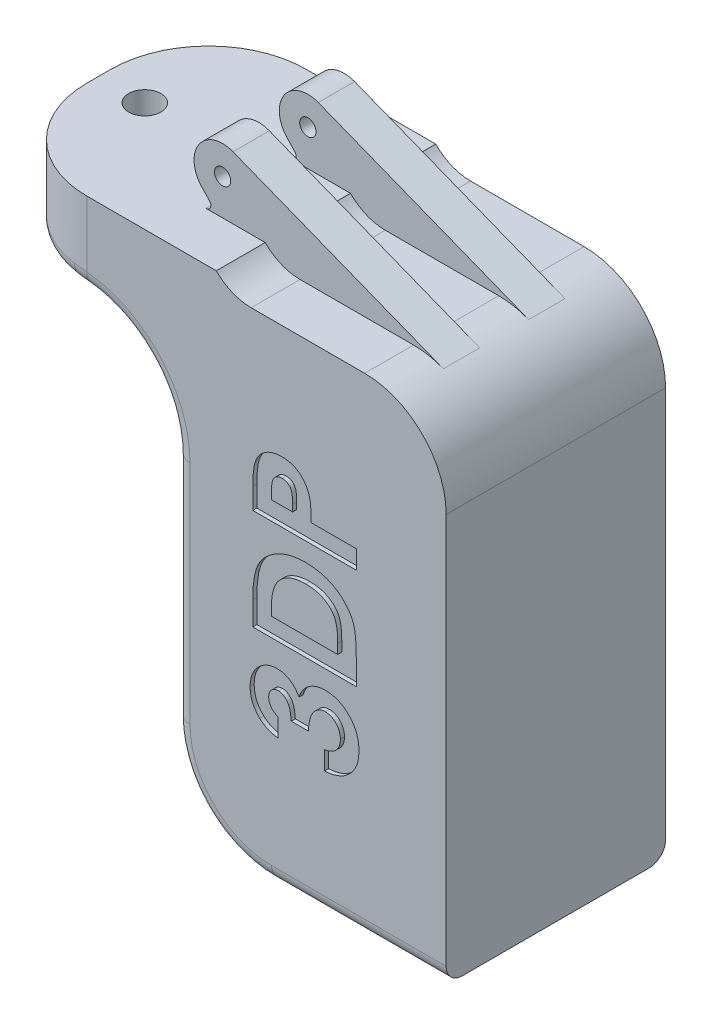
from build123d import *

# Parameters (mm, degrees)
BOSS_EXTRUDE1_DEPTH = 26.91519165
BOSS_EXTRUDE2_DEPTH = 26.91519165
FILLET1_R           = 12
FILLET2_R           = 12
SKETCH4_R           = 1.975
CUT_EXTRUDE1_DEPTH  = 5
FILLET3_R           = 2
FILLET4_R           = 0.6
SKETCH5_R           = 1
CUT_EXTRUDE2_DEPTH  = 33
SKETCH6_W           = 18.03011809
SKETCH6_H           = 6
CUT_EXTRUDE3_DEPTH  = 33
SKETCH7_W           = 12.282064414
SKETCH7_H           = 6
CUT_EXTRUDE4_DEPTH  = 33
FILLET5_R           = 10
BOSS_EXTRUDE3_DEPTH = 4.457595825
BOSS_EXTRUDE4_START = -4.457595825
BOSS_EXTRUDE4_DEPTH = 4.457595825
WRAP1_START         = -0.5
WRAP1_DEPTH         = 0.5
WRAP2_START         = -0.5
WRAP2_DEPTH         = 0.5


# Read off the part's stored shape, not the designer's step: Wrap1, Wrap2
with BuildPart() as part:
    # Sketch1 → Boss-Extrude1 (new body)
    with BuildSketch(Plane.XY):
        with BuildLine():
            Line((20.5, -63.197553089), (50.42158649, -63.197553089))
            Line((50.42158649, -63.197553089), (50.42158649, -3.197553089))
            Line((50.42158649, -3.197553089), (26.5, -3.197553089))
            ThreePointArc((26.5, -3.197553089), (22.257359313, -1.440193776), (20.5, 2.802446911))
            Line((20.5, 2.802446911), (20.5, 3))
            ThreePointArc((20.5, 3), (15.70294041, 6.250790123), (14.461350617, 0.590589427))
            Line((14.461350617, 0.590589427), (17, -2.08423103))
            Line((17, -2.08423103), (17, -63.197553089))
            Line((17, -63.197553089), (20.5, -63.197553089))
        make_face()
    extrude(amount=-BOSS_EXTRUDE1_DEPTH)

    # Sketch3 → Boss-Extrude2 (add)
    with BuildSketch(Plane.XY):
        Polygon((16.359537753, -1.409414913), (-5.640462247, -1.409414913), (-5.640462247, -11.409414913), (17, -11.409414913), (17, -2.08423103), align=None)
    extrude(amount=-BOSS_EXTRUDE2_DEPTH)

    # Fillet1
    fillet1_edges = [part.edges().sort_by_distance(p)[0] for p in [
        (-5.640462247, -6.409414913, 0),
        (-5.640462247, -6.409414913, -26.91519165),
    ]]
    fillet(fillet1_edges, radius=FILLET1_R)

    # Fillet2
    fillet2_edges = [part.edges().sort_by_distance(p)[0] for p in [
        (17, -63.197553089, -13.457595825),
        (17, -11.409414913, -13.457595825),
    ]]
    fillet(fillet2_edges, radius=FILLET2_R)

    # Sketch4 → Cut-Extrude1 (cut)
    with BuildSketch(Plane(origin=(0, -1.409414913, 0), x_dir=(1, 0, 0), z_dir=(0, 1, 0))):
        with Locations(Location((0, 13.457595825, 0), (0, 0, 180))):
            Circle(SKETCH4_R)
    extrude(amount=-CUT_EXTRUDE1_DEPTH, mode=Mode.SUBTRACT)

    # Fillet3
    fillet3_edges = [part.edges().sort_by_distance(p)[0] for p in [
        (-5.640462247, -11.409414913, -13.457595825),
        (-2.593519072, -11.409414913, -22.90535895),
        (17, -37.303484001, -26.91519165),
        (17, -37.303484001, 0),
        (39.710793245, -63.197553089, 0),
        (20.514718626, -59.682834464, 0),
        (39.710793245, -63.197553089, -26.91519165),
        (20.514718626, -59.682834464, -26.91519165),
        (-2.593519072, -11.409414913, -4.0098327),
        (5.679768877, -11.428683956, -0.019269043),
        (13.953056825, -15.419247614, 0),
        (13.953056825, -15.419247614, -26.91519165),
        (5.679768877, -11.428683956, -26.895922607),
    ]]
    fillet(fillet3_edges, radius=FILLET3_R)

    # Fillet4
    fillet4_edges = [part.edges().sort_by_distance(p)[0] for p in [
        (16.359537753, -1.409414913, -13.457595825),
    ]]
    fillet(fillet4_edges, radius=FILLET4_R)

    # Sketch5 → Cut-Extrude2 (cut)
    with BuildSketch(Plane.XY):
        with Locations((17, 3)):
            Circle(SKETCH5_R)
    extrude(amount=-CUT_EXTRUDE2_DEPTH, mode=Mode.SUBTRACT)

    # Sketch6 → Cut-Extrude3 (cut)
    with BuildSketch(Plane(origin=(0, -1.409414913, 0), x_dir=(1, 0, 0), z_dir=(0, 1, 0))):
        with Locations((18.559970367, 3)):
            Rectangle(SKETCH6_W, SKETCH6_H)
    extrude(amount=CUT_EXTRUDE3_DEPTH, mode=Mode.SUBTRACT)

    # Sketch7 → Cut-Extrude4 (cut)
    with BuildSketch(Plane(origin=(0, -1.409414913, 0), x_dir=(1, 0, 0), z_dir=(0, 1, 0))):
        with Locations((16.08576993, 23.91519165)):
            Rectangle(SKETCH7_W, SKETCH7_H)
        with Locations((16.08576993, 13.457595825)):
            Rectangle(SKETCH7_W, SKETCH7_H)
    extrude(amount=CUT_EXTRUDE4_DEPTH, mode=Mode.SUBTRACT)

    # Fillet5
    fillet5_edges = [part.edges().sort_by_distance(p)[0] for p in [
        (50.42158649, -3.197553089, -13.457595825),
    ]]
    fillet(fillet5_edges, radius=FILLET5_R)

    # Sketch8 → Boss-Extrude3 (add)
    with BuildSketch(Plane.XY.offset(-6)):
        with BuildLine():
            Line((18.28116245, 6.257088082), (44.082050633, -3.89158714))
            ThreePointArc((44.082050633, -3.89158714), (42.284425788, -3.37259356), (40.42158649, -3.197553089))
            Line((40.42158649, -3.197553089), (26.5, -3.197553089))
            ThreePointArc((26.5, -3.197553089), (24.183879423, -2.732495318), (22.226802137, -1.409414913))
            ThreePointArc((22.226802137, -1.409414913), (20.948460251, 0.526396294), (20.5, 2.802446911))
            Line((20.5, 2.802446911), (20.5, 3))
            ThreePointArc((20.5, 3), (19.892582633, 4.970524223), (18.28116245, 6.257088082))
        make_face()
    extrude(amount=-BOSS_EXTRUDE3_DEPTH)

    # Sketch10 → Boss-Extrude4 (add)
    with BuildSketch(Plane(origin=(0, 0, -20.91519165), x_dir=(-1, 0, 0), z_dir=(0, 0, -1)).offset(BOSS_EXTRUDE4_START)):
        with BuildLine():
            Line((-44.082050633, -3.89158714), (-18.28116245, 6.257088082))
            ThreePointArc((-18.28116245, 6.257088082), (-19.892582633, 4.970524223), (-20.5, 3))
            Line((-20.5, 3), (-20.5, 2.802446911))
            ThreePointArc((-20.5, 2.802446911), (-20.948460251, 0.526396294), (-22.226802137, -1.409414913))
            ThreePointArc((-22.226802137, -1.409414913), (-24.183879423, -2.732495318), (-26.5, -3.197553089))
            Line((-26.5, -3.197553089), (-40.42158649, -3.197553089))
            ThreePointArc((-40.42158649, -3.197553089), (-42.284425788, -3.37259356), (-44.082050633, -3.89158714))
        make_face()
    extrude(amount=BOSS_EXTRUDE4_DEPTH)

    # Wrap1 outline → Wrap1 (cut)
    # profile 1 of 3: a face of its own
    with BuildSketch(Plane.XY.offset(WRAP1_START)):
        with BuildLine():
            add(Edge.make_bspline(
                [(29.793662682, -47.259674624), (29.679694315, -47.243680976), (29.457085889, -47.212441424), (29.134033392, -47.135646016), (28.826834298, -47.046836784), (28.53713725, -46.933262335), (28.265254543, -46.802161124), (28.010942879, -46.649279319), (27.770552672, -46.481710734), (27.626494259, -46.350515009), (27.554880631, -46.285295618)],
                knots=[0, 0, 0, 0, 0.138943325, 0.2713907, 0.400711228, 0.524932707, 0.646800357, 0.764858493, 0.883107579, 1, 1, 1, 1], degree=3))
            Line((29.793662682, -47.259674624), (29.793662682, -44.980187445))
            add(Edge.make_bspline(
                [(28.653919092, -43.494450265), (28.657984461, -43.577042735), (28.666051398, -43.740931491), (28.726260879, -43.980585907), (28.827616047, -44.208177758), (28.96737885, -44.418994259), (29.135228052, -44.60999223), (29.334010592, -44.766746459), (29.551817063, -44.897127195), (29.712731442, -44.952392155), (29.793662682, -44.980187445)],
                knots=[0, 0, 0, 0, 0.123522589, 0.245106649, 0.36726561, 0.494690546, 0.622323873, 0.746002836, 0.872253148, 1, 1, 1, 1], degree=3))
            add(Edge.make_bspline(
                [(29.849632233, -42.212238727), (29.766930947, -42.21661778), (29.605515545, -42.225164764), (29.374084101, -42.29284717), (29.166688952, -42.407707014), (28.985649891, -42.563553512), (28.837973958, -42.755012631), (28.728141079, -42.976591692), (28.664068623, -43.227167915), (28.657378891, -43.40333836), (28.653919092, -43.494450265)],
                knots=[0, 0, 0, 0, 0.126165598, 0.246248538, 0.364494603, 0.485724426, 0.608514578, 0.73130473, 0.861036067, 1, 1, 1, 1], degree=3))
            add(Edge.make_bspline(
                [(31.42186781, -44.654546419), (31.40904774, -44.503428084), (31.385063928, -44.220715606), (31.328187448, -43.828565407), (31.254610772, -43.497301408), (31.158720422, -43.223137182), (31.046713588, -42.99171911), (30.916934876, -42.792391977), (30.767908317, -42.618485027), (30.599851049, -42.475439303), (30.423692764, -42.356231745), (30.236339235, -42.27462788), (30.045244717, -42.21993119), (29.914444082, -42.214787453), (29.849632233, -42.212238727)],
                knots=[0, 0, 0, 0, 0.141725991, 0.265141262, 0.370116044, 0.458355648, 0.535986621, 0.609852304, 0.680090865, 0.749211452, 0.815601441, 0.878051616, 0.93957445, 1, 1, 1, 1], degree=3))
            Line((31.42186781, -44.654546419), (33.538534477, -44.654546419))
            add(Edge.make_bspline(
                [(35.591599381, -41.560956675), (35.521865865, -41.563278441), (35.383876528, -41.567872773), (35.181659761, -41.608302676), (34.986390275, -41.668820275), (34.799679191, -41.755855816), (34.622624577, -41.869745696), (34.45376006, -42.00822411), (34.294430079, -42.17254377), (34.139994301, -42.35720205), (34.004801952, -42.569649592), (33.880310015, -42.801307426), (33.78118375, -43.057882639), (33.692667259, -43.333219952), (33.628010792, -43.632496359), (33.581065463, -43.953862488), (33.546121475, -44.296797294), (33.541108222, -44.533186823), (33.538534477, -44.654546419)],
                knots=[0, 0, 0, 0, 0.050616766, 0.100160932, 0.149266408, 0.198883313, 0.249304704, 0.301846101, 0.357178164, 0.415398685, 0.476408327, 0.539798233, 0.60615782, 0.675919782, 0.74976587, 0.828276339, 0.911839098, 1, 1, 1, 1], degree=3))
            add(Edge.make_bspline(
                [(37.446226785, -43.560596098), (37.445011729, -43.490133273), (37.442631707, -43.352112362), (37.416491829, -43.149328443), (37.372939422, -42.956346104), (37.31535741, -42.771562698), (37.237218938, -42.597882151), (37.146539501, -42.431372035), (37.03553414, -42.27507746), (36.909054065, -42.129908906), (36.773996634, -41.994805434), (36.626208402, -41.879442714), (36.472785654, -41.779844315), (36.30967031, -41.701254478), (36.142011638, -41.635479646), (35.964480714, -41.594456903), (35.780931109, -41.563668655), (35.655339645, -41.561869688), (35.591599381, -41.560956675)],
                knots=[0, 0, 0, 0, 0.069418935, 0.135976164, 0.201068785, 0.264244252, 0.326365932, 0.38847074, 0.450850536, 0.514855453, 0.578097235, 0.638796917, 0.699312171, 0.757998888, 0.816988375, 0.876385038, 0.937262852, 1, 1, 1, 1], degree=3))
            add(Edge.make_bspline(
                [(35.492380631, -45.631469496), (35.572252479, -45.617021806), (35.727823851, -45.588881142), (35.953078761, -45.53404413), (36.160921135, -45.462395911), (36.35287794, -45.380480737), (36.530919166, -45.289913895), (36.690283678, -45.181702221), (36.837234507, -45.065675298), (37.006144585, -44.891260395), (37.183282522, -44.647911648), (37.340163988, -44.318431755), (37.429388386, -43.950244583), (37.440489168, -43.693367265), (37.446226785, -43.560596098)],
                knots=[0, 0, 0, 0, 0.077370852, 0.150700025, 0.220747386, 0.286665961, 0.349581574, 0.410791325, 0.470003976, 0.527741387, 0.64173813, 0.755286834, 0.87351607, 1, 1, 1, 1], degree=3))
            Line((35.492380631, -45.631469496), (35.492380631, -47.910956675))
            add(Edge.make_bspline(
                [(39.725713964, -43.685255553), (39.72247289, -43.833828888), (39.716135397, -44.124344383), (39.66128119, -44.549284097), (39.572796902, -44.953149071), (39.448070962, -45.336969976), (39.286322731, -45.69926184), (39.093716882, -46.043310066), (38.859144355, -46.362249248), (38.593194199, -46.659632995), (38.294813224, -46.92886444), (37.970913277, -47.169493949), (37.620262701, -47.3762156), (37.244359619, -47.54987716), (36.842544586, -47.689120989), (36.415634712, -47.798956113), (35.962795948, -47.875677745), (35.651233245, -47.899043478), (35.492380631, -47.910956675)],
                knots=[0, 0, 0, 0, 0.066659045, 0.130342942, 0.191936224, 0.251995802, 0.311121943, 0.3697548, 0.428602208, 0.488435845, 0.548524359, 0.60866107, 0.669235799, 0.730880799, 0.794196272, 0.859830406, 0.928533466, 1, 1, 1, 1], degree=3))
            add(Edge.make_bspline(
                [(35.614496015, -39.281469496), (35.75541144, -39.285828806), (36.03326796, -39.294424477), (36.442521412, -39.349073074), (36.832711166, -39.450814953), (37.208313016, -39.584675133), (37.564529662, -39.76318106), (37.909339638, -39.973432657), (38.231049551, -40.230787146), (38.535833303, -40.519386069), (38.814280771, -40.838218648), (39.060292199, -41.181303188), (39.263089604, -41.549304401), (39.436428178, -41.933325424), (39.565072658, -42.342017422), (39.659280759, -42.770093658), (39.716599833, -43.22068011), (39.722632856, -43.528201954), (39.725713964, -43.685255553)],
                knots=[0, 0, 0, 0, 0.062826775, 0.123881606, 0.183570574, 0.242287944, 0.301291813, 0.360878938, 0.421986412, 0.484557904, 0.547788277, 0.610411137, 0.672354816, 0.73480514, 0.797929196, 0.862961244, 0.93001333, 1, 1, 1, 1], degree=3))
            add(Edge.make_bspline(
                [(32.36571797, -41.63219065), (32.395435252, -41.541662854), (32.453828378, -41.363779795), (32.568904013, -41.110991399), (32.694395385, -40.870420668), (32.840893141, -40.647569372), (32.998243164, -40.436326343), (33.1749057, -40.243375025), (33.366346101, -40.063719006), (33.574600933, -39.901802756), (33.796207672, -39.757042122), (34.027183263, -39.629465989), (34.268371885, -39.522405635), (34.518001132, -39.432550417), (34.778527767, -39.363993374), (35.049068901, -39.315761008), (35.328972672, -39.287872438), (35.518608617, -39.283619798), (35.614496015, -39.281469496)],
                knots=[0, 0, 0, 0, 0.066210963, 0.130101573, 0.192891272, 0.254723742, 0.31534918, 0.375885633, 0.436387606, 0.497731609, 0.559069942, 0.62030329, 0.681020445, 0.742389955, 0.80461491, 0.86812333, 0.933317965, 1, 1, 1, 1], degree=3))
            add(Edge.make_bspline(
                [(29.704620214, -39.932751547), (29.842416769, -39.938147512), (30.114526826, -39.948803049), (30.511996536, -40.033072716), (30.891185338, -40.168541012), (31.247600382, -40.361156854), (31.58087039, -40.603040267), (31.879355738, -40.899664437), (32.147678995, -41.242751757), (32.291877756, -41.500304819), (32.36571797, -41.63219065)],
                knots=[0, 0, 0, 0, 0.124097087, 0.245057399, 0.36448446, 0.485868975, 0.60892619, 0.734308661, 0.863946782, 1, 1, 1, 1], degree=3))
            add(Edge.make_bspline(
                [(26.374431913, -43.479185842), (26.37733782, -43.35609612), (26.383050248, -43.114126531), (26.428906519, -42.758492119), (26.509333311, -42.419424469), (26.614489538, -42.093339536), (26.757572159, -41.785032969), (26.923660628, -41.487700142), (27.127375037, -41.209648544), (27.357551818, -40.950227588), (27.60651054, -40.711899962), (27.872626939, -40.505507193), (28.148792434, -40.328067627), (28.437301437, -40.181880894), (28.73864214, -40.069483162), (29.051073738, -39.991475802), (29.373906829, -39.940418092), (29.593332132, -39.93533141), (29.704620214, -39.932751547)],
                knots=[0, 0, 0, 0, 0.068213911, 0.134094803, 0.198285615, 0.261160186, 0.323634654, 0.38636675, 0.449642386, 0.514244902, 0.578413338, 0.640374686, 0.70061485, 0.760103977, 0.81929898, 0.878465984, 0.938360402, 1, 1, 1, 1], degree=3))
            add(Edge.make_bspline(
                [(27.554880631, -46.285295618), (27.460245557, -46.191457288), (27.273729773, -46.006511803), (27.034823657, -45.697446207), (26.82806666, -45.373488384), (26.664148218, -45.02814122), (26.531475228, -44.666778575), (26.442358481, -44.28652677), (26.383228733, -43.88893965), (26.377404247, -43.617636458), (26.374431913, -43.479185842)],
                knots=[0, 0, 0, 0, 0.127406864, 0.251105539, 0.372907792, 0.494496302, 0.616171436, 0.740562898, 0.867604851, 1, 1, 1, 1], degree=3))
        make_face()
    # profile 2 of 3: a face of its own
    with BuildSketch(Plane.XY.offset(WRAP1_START)):
        with BuildLine():
            add(Edge.make_bspline(
                [(26.700072938, -34.129726707), (26.701602041, -33.905795857), (26.704557813, -33.472934992), (26.73913827, -32.845894461), (26.789912576, -32.262388484), (26.867639291, -31.723746195), (26.957795121, -31.227997365), (27.078733297, -30.778902431), (27.216634224, -30.373204929), (27.379324524, -30.006964684), (27.568904674, -29.672607458), (27.78010635, -29.355128565), (28.020637712, -29.055146138), (28.285866069, -28.768451804), (28.580641597, -28.498745033), (28.900082319, -28.241534344), (29.248820405, -28.003117396), (29.618494261, -27.776287366), (30.010670516, -27.571149788), (30.422011051, -27.392221126), (30.849868736, -27.242331502), (31.294699556, -27.120538419), (31.755026808, -27.023455277), (32.231779389, -26.955528159), (32.724515906, -26.913534938), (33.058467638, -26.909275076), (33.228157874, -26.907110521)],
                knots=[0, 0, 0, 0, 0.060148874, 0.116268453, 0.168655952, 0.21743294, 0.262424792, 0.303924461, 0.342252181, 0.37743397, 0.411399132, 0.445391786, 0.479760229, 0.514578736, 0.550208327, 0.586996019, 0.624658544, 0.663611474, 0.703452918, 0.743447125, 0.784010829, 0.825130466, 0.867263092, 0.910305411, 0.954423665, 1, 1, 1, 1], degree=3))
            Line((26.700072938, -34.129726707), (26.700072938, -37.001982316))
            Line((26.700072938, -37.001982316), (39.400072938, -37.001982316))
            Line((39.400072938, -37.001982316), (39.400072938, -34.086477509))
            add(Edge.make_bspline(
                [(33.228157874, -26.907110521), (33.467601844, -26.912778495), (33.938961313, -26.923936232), (34.630675905, -27.017922776), (35.293753331, -27.169930842), (35.923006744, -27.383667989), (36.512832544, -27.648644836), (37.052829427, -27.965189349), (37.540098861, -28.328660259), (37.972215016, -28.73482307), (38.343623694, -29.174598582), (38.661711623, -29.63161364), (38.912537941, -30.110322131), (39.071637644, -30.532127029), (39.17049322, -30.897894585), (39.229227491, -31.219000738), (39.281638665, -31.583991303), (39.328451546, -31.995286488), (39.359650825, -32.452845815), (39.381498194, -32.956746724), (39.397647795, -33.506328066), (39.399243376, -33.888027214), (39.400072938, -34.086477509)],
                knots=[0, 0, 0, 0, 0.065772437, 0.129476892, 0.191428604, 0.252443711, 0.311784541, 0.368814691, 0.42408823, 0.478488396, 0.531389624, 0.581999458, 0.631196377, 0.67949774, 0.705555904, 0.735216023, 0.769126523, 0.806877245, 0.848930943, 0.895117474, 0.945470227, 1, 1, 1, 1], degree=3))
        make_face()
        with BuildLine():
            add(Edge.make_bspline(
                [(37.120585759, -33.531870137), (37.119899873, -33.390228608), (37.118580886, -33.11784605), (37.100458158, -32.72410683), (37.071029, -32.360739082), (37.027498843, -32.027266845), (36.975120922, -31.722923489), (36.910336338, -31.448819175), (36.83155335, -31.20441365), (36.738706801, -30.987691442), (36.632701869, -30.789828851), (36.508920795, -30.606525159), (36.371360763, -30.429614765), (36.216100559, -30.262367314), (36.045162194, -30.104160228), (35.857674297, -29.955926689), (35.654206307, -29.815688968), (35.433683163, -29.687046482), (35.198433435, -29.569492301), (34.950735917, -29.465208567), (34.688527805, -29.378741964), (34.414263688, -29.306876217), (34.125555784, -29.255519992), (33.824542513, -29.213032511), (33.510031286, -29.191128977), (33.296027335, -29.188122853), (33.187452746, -29.186597701)],
                knots=[0, 0, 0, 0, 0.062612326, 0.120406111, 0.174204843, 0.223728185, 0.269030291, 0.310675957, 0.348139427, 0.382401014, 0.41477486, 0.447215928, 0.480063858, 0.51375667, 0.547979264, 0.582933279, 0.619329216, 0.657136258, 0.695697859, 0.735523522, 0.775831512, 0.817659023, 0.860747747, 0.905390435, 0.951999977, 1, 1, 1, 1], degree=3))
            Line((37.120585759, -33.531870137), (37.120585759, -34.722495137))
            Line((37.120585759, -34.722495137), (28.979560118, -34.722495137))
            Line((28.979560118, -34.722495137), (28.979560118, -33.852423021))
            add(Edge.make_bspline(
                [(29.997188323, -30.384854912), (29.914513245, -30.479314588), (29.745658759, -30.672237781), (29.543327904, -31.010947509), (29.365560415, -31.384188086), (29.224610622, -31.80049814), (29.113141516, -32.255854217), (29.036264, -32.752968428), (28.986863323, -33.289178618), (28.982046675, -33.660652544), (28.979560118, -33.852423021)],
                knots=[0, 0, 0, 0, 0.101663476, 0.207636138, 0.318744567, 0.436679942, 0.563506646, 0.698681208, 0.844446556, 1, 1, 1, 1], degree=3))
            add(Edge.make_bspline(
                [(33.187452746, -29.186597701), (33.021068674, -29.189624393), (32.696632625, -29.195526208), (32.224147528, -29.252797822), (31.779788909, -29.345079103), (31.364698281, -29.479507423), (30.976236729, -29.644819104), (30.619410066, -29.855016361), (30.288369519, -30.097329689), (30.094206114, -30.289055244), (29.997188323, -30.384854912)],
                knots=[0, 0, 0, 0, 0.142280365, 0.277435688, 0.406487662, 0.529917848, 0.650133875, 0.766844668, 0.88349908, 1, 1, 1, 1], degree=3))
        make_face(mode=Mode.SUBTRACT)
    # profile 3 of 3: a face of its own
    with BuildSketch(Plane.XY.offset(WRAP1_START)):
        with BuildLine():
            add(Edge.make_bspline(
                [(26.700072938, -22.083552829), (26.700817001, -21.917326561), (26.702252455, -21.596641247), (26.719659281, -21.134186657), (26.750853288, -20.707549596), (26.789404406, -20.31682834), (26.843450697, -19.962182705), (26.905413212, -19.643171282), (26.980892876, -19.359719159), (27.070513958, -19.108657994), (27.17608129, -18.883269215), (27.288838892, -18.670229349), (27.422495572, -18.472744789), (27.567417095, -18.286179159), (27.726618424, -18.111943735), (27.899470362, -17.9487474), (28.08848495, -17.798270622), (28.292360047, -17.661456795), (28.506944899, -17.537277383), (28.732728851, -17.428803993), (28.970040429, -17.340811847), (29.217352269, -17.266998673), (29.474651457, -17.207710866), (29.743520998, -17.168247098), (30.022083378, -17.141441297), (30.211673116, -17.139076057), (30.307564926, -17.137879752)],
                knots=[0, 0, 0, 0, 0.070782813, 0.136554884, 0.197017081, 0.252928598, 0.303693621, 0.349727315, 0.391249604, 0.428488557, 0.463067374, 0.497161963, 0.531014729, 0.564460573, 0.597691279, 0.631412817, 0.665589541, 0.700444444, 0.735874519, 0.771086765, 0.806970339, 0.84353075, 0.880937416, 0.9192925, 0.959179287, 1, 1, 1, 1], degree=3))
            Line((26.700072938, -22.083552829), (26.700072938, -24.627623342))
            Line((26.700072938, -24.627623342), (39.400072938, -24.627623342))
            Line((39.400072938, -24.627623342), (39.400072938, -22.348136162))
            Line((39.400072938, -22.348136162), (33.864175502, -22.348136162))
            add(Edge.make_bspline(
                [(33.670826144, -19.760816451), (33.687024281, -19.825921081), (33.722114662, -19.966958675), (33.757740207, -20.200337155), (33.790495705, -20.469281349), (33.81864509, -20.774660931), (33.837780113, -21.116651958), (33.852723715, -21.494923294), (33.863589256, -21.909646365), (33.863974813, -22.19802839), (33.864175502, -22.348136162)],
                knots=[0, 0, 0, 0, 0.077372749, 0.167614291, 0.272108317, 0.390015992, 0.52136331, 0.667272254, 0.826809521, 1, 1, 1, 1], degree=3))
            add(Edge.make_bspline(
                [(30.307564926, -17.137879752), (30.41364775, -17.139610657), (30.622113537, -17.143012097), (30.927698814, -17.176357162), (31.21904667, -17.233321097), (31.498614271, -17.307769884), (31.761801475, -17.411583781), (32.014890331, -17.530185046), (32.250776514, -17.67610688), (32.472442478, -17.842828857), (32.681571719, -18.024971364), (32.872566669, -18.226564463), (33.045370282, -18.445233691), (33.207455414, -18.674906282), (33.345843948, -18.925046025), (33.474930503, -19.186896398), (33.584309307, -19.467049464), (33.641719441, -19.661984956), (33.670826144, -19.760816451)],
                knots=[0, 0, 0, 0, 0.068872788, 0.135343493, 0.199281685, 0.261540067, 0.322903021, 0.382757342, 0.442826617, 0.502632784, 0.562727297, 0.622715739, 0.682661194, 0.743612561, 0.80501998, 0.868072172, 0.933113132, 1, 1, 1, 1], degree=3))
        make_face()
        with BuildLine():
            add(Edge.make_bspline(
                [(31.584688323, -21.54166581), (31.583757964, -21.394915623), (31.58204609, -21.124893098), (31.557285692, -20.756140104), (31.519478886, -20.459796041), (31.465236039, -20.225697419), (31.382970387, -20.040800969), (31.287637979, -19.881520202), (31.167270123, -19.743766196), (31.027412074, -19.627020793), (30.869864608, -19.532154818), (30.695049852, -19.465470042), (30.505460647, -19.42341865), (30.37309273, -19.419422171), (30.305020855, -19.417366932)],
                knots=[0, 0, 0, 0, 0.155183108, 0.285539224, 0.390561991, 0.471046427, 0.538527135, 0.603746832, 0.666688199, 0.730994992, 0.79575053, 0.860207253, 0.928109812, 1, 1, 1, 1], degree=3))
            Line((31.584688323, -21.54166581), (31.584688323, -22.348136162))
            Line((31.584688323, -22.348136162), (28.979560118, -22.348136162))
            Line((28.979560118, -22.348136162), (28.979560118, -21.630708278))
            add(Edge.make_bspline(
                [(29.231423099, -20.015223502), (29.211033986, -20.05553981), (29.167866055, -20.140897695), (29.11768018, -20.28627045), (29.075342866, -20.454028388), (29.040203304, -20.645304066), (29.012931355, -20.85933443), (28.992075136, -21.096081293), (28.983688038, -21.35589305), (28.980974043, -21.536576582), (28.979560118, -21.630708278)],
                knots=[0, 0, 0, 0, 0.08210116, 0.173824981, 0.278953094, 0.396639095, 0.527315592, 0.671298143, 0.82875438, 1, 1, 1, 1], degree=3))
            add(Edge.make_bspline(
                [(30.305020855, -19.417366932), (30.245531576, -19.419357276), (30.130108071, -19.423219021), (29.96364049, -19.451979434), (29.808762722, -19.496617062), (29.66763372, -19.564837016), (29.536961778, -19.647662256), (29.420814746, -19.752736375), (29.315434874, -19.873908431), (29.259725884, -19.967615769), (29.231423099, -20.015223502)],
                knots=[0, 0, 0, 0, 0.137806221, 0.267377201, 0.390496855, 0.51006691, 0.629459141, 0.747795142, 0.871868075, 1, 1, 1, 1], degree=3))
        make_face(mode=Mode.SUBTRACT)
    extrude(amount=WRAP1_DEPTH, mode=Mode.SUBTRACT)

    # Wrap2 outline → Wrap2 (cut)
    # profile 1 of 3: a face of its own
    with BuildSketch(Plane(origin=(0, 0, -26.91519165), x_dir=(-1, 0, 0), z_dir=(0, 0, -1)).offset(WRAP2_START)):
        with BuildLine():
            add(Edge.make_bspline(
                [(-28.287572938, -42.789742733), (-28.288223995, -42.935190717), (-28.289480018, -43.215790365), (-28.304710977, -43.620438143), (-28.332005783, -43.993745531), (-28.365737846, -44.335626763), (-28.413028886, -44.645941264), (-28.467244362, -44.925077642), (-28.533294589, -45.173093824), (-28.611695294, -45.392786562), (-28.704126662, -45.589953698), (-28.802572667, -45.7765374), (-28.920064501, -45.948320858), (-29.043939394, -46.1139745), (-29.186031068, -46.264027622), (-29.336883113, -46.407841437), (-29.5024782, -46.539325037), (-29.680811844, -46.659087668), (-29.868589201, -46.767730828), (-30.066145962, -46.862648761), (-30.27379474, -46.939640873), (-30.490192284, -47.004227681), (-30.715329161, -47.056104434), (-30.950589985, -47.090635253), (-31.194332074, -47.114090322), (-31.360223094, -47.116159908), (-31.444128427, -47.117206675)],
                knots=[0, 0, 0, 0, 0.070781161, 0.136551696, 0.197012482, 0.252922694, 0.303686532, 0.349719151, 0.391240471, 0.428478555, 0.463056565, 0.497150358, 0.531002334, 0.564226377, 0.59770067, 0.631421421, 0.665597347, 0.700451436, 0.735880684, 0.771092108, 0.806974845, 0.843534403, 0.880940196, 0.919294384, 0.95918024, 1, 1, 1, 1], degree=3))
            Line((-28.287572938, -42.789742733), (-28.287572938, -40.563681034))
            Line((-28.287572938, -40.563681034), (-39.400072938, -40.563681034))
            Line((-39.400072938, -40.563681034), (-39.400072938, -42.558232316))
            Line((-39.400072938, -42.558232316), (-34.556162682, -42.558232316))
            add(Edge.make_bspline(
                [(-34.386981993, -44.822137064), (-34.401155363, -44.765170513), (-34.431859447, -44.641762618), (-34.463031799, -44.437556448), (-34.491692859, -44.202230278), (-34.516323571, -43.935023144), (-34.533066716, -43.635780995), (-34.546142368, -43.304793576), (-34.555649717, -42.941910889), (-34.555987079, -42.689576617), (-34.556162682, -42.558232316)],
                knots=[0, 0, 0, 0, 0.077372749, 0.167614291, 0.272108317, 0.390015992, 0.52136331, 0.667272254, 0.826809521, 1, 1, 1, 1], degree=3))
            add(Edge.make_bspline(
                [(-31.444128427, -47.117206675), (-31.536953589, -47.1156987), (-31.719366438, -47.112735343), (-31.986715453, -47.083465404), (-32.24178206, -47.033956943), (-32.485655749, -46.967678892), (-32.717803555, -46.881228717), (-32.936698432, -46.772876615), (-33.145090744, -46.648940605), (-33.339141372, -46.502614356), (-33.519941978, -46.340978275), (-33.689073682, -46.166730769), (-33.840760074, -45.975922153), (-33.977894661, -45.771211318), (-34.103334712, -45.554292429), (-34.21532969, -45.324170805), (-34.311343496, -45.079221454), (-34.36153507, -44.908627499), (-34.386981993, -44.822137064)],
                knots=[0, 0, 0, 0, 0.068862946, 0.135324151, 0.199253206, 0.26150269, 0.322661372, 0.382747297, 0.442522097, 0.502319717, 0.562770359, 0.622352107, 0.682288995, 0.743375754, 0.805047844, 0.868091026, 0.933122691, 1, 1, 1, 1], degree=3))
        make_face()
        with BuildLine():
            add(Edge.make_bspline(
                [(-32.5616114, -43.263893875), (-32.560800105, -43.392302083), (-32.559307311, -43.628575094), (-32.537610461, -43.95121355), (-32.504616386, -44.210570907), (-32.456925665, -44.415259299), (-32.385866665, -44.57689616), (-32.300307361, -44.714783459), (-32.19733753, -44.836284287), (-32.075941438, -44.939765458), (-31.937796285, -45.02272296), (-31.78375377, -45.08012126), (-31.617315346, -45.117439733), (-31.501474821, -45.120884089), (-31.441902365, -45.122655393)],
                knots=[0, 0, 0, 0, 0.155172457, 0.285519625, 0.390535184, 0.471014095, 0.538490172, 0.60294247, 0.666559525, 0.730176579, 0.794927673, 0.860216848, 0.928114746, 1, 1, 1, 1], degree=3))
            Line((-32.5616114, -43.263893875), (-32.5616114, -42.558232316))
            Line((-32.5616114, -42.558232316), (-30.28212422, -42.558232316))
            Line((-30.28212422, -42.558232316), (-30.28212422, -43.185981715))
            add(Edge.make_bspline(
                [(-30.502504329, -44.599530894), (-30.484663855, -44.564254125), (-30.446891916, -44.489565975), (-30.402979275, -44.362364815), (-30.365934125, -44.215576619), (-30.335187008, -44.048210401), (-30.311324053, -43.860933832), (-30.293074861, -43.653780327), (-30.28573615, -43.42644504), (-30.283361405, -43.26834695), (-30.28212422, -43.185981715)],
                knots=[0, 0, 0, 0, 0.08210116, 0.173824981, 0.278953094, 0.396639095, 0.527315592, 0.671298143, 0.82875438, 1, 1, 1, 1], degree=3))
            add(Edge.make_bspline(
                [(-31.441902365, -45.122655393), (-31.389855475, -45.120901587), (-31.288871992, -45.11749878), (-31.143127779, -45.092500836), (-31.007264107, -45.052661305), (-30.882699892, -44.994935356), (-30.769646789, -44.920309373), (-30.668149332, -44.829325197), (-30.576033869, -44.723150335), (-30.527275747, -44.641177134), (-30.502504329, -44.599530894)],
                knots=[0, 0, 0, 0, 0.137787685, 0.267341238, 0.390444331, 0.511777883, 0.629508981, 0.747829066, 0.87188531, 1, 1, 1, 1], degree=3))
        make_face(mode=Mode.SUBTRACT)
    # profile 2 of 3: a face of its own
    with BuildSketch(Plane(origin=(0, 0, -26.91519165), x_dir=(-1, 0, 0), z_dir=(0, 0, -1)).offset(WRAP2_START)):
        with BuildLine():
            add(Edge.make_bspline(
                [(-28.287572938, -32.24934059), (-28.288942662, -32.44527525), (-28.291590355, -32.824019164), (-28.321420886, -33.372744668), (-28.367303038, -33.882987756), (-28.430406229, -34.355085348), (-28.513961784, -34.788042865), (-28.618593746, -35.181390544), (-28.740150314, -35.536797385), (-28.881413673, -35.858438205), (-29.04717177, -36.151249745), (-29.233372438, -36.427315816), (-29.442834184, -36.689818875), (-29.676037929, -36.940214885), (-29.93143493, -37.179113731), (-30.214167316, -37.400907555), (-30.51691208, -37.612706879), (-30.840719934, -37.81107525), (-31.184951612, -37.987647874), (-31.544189152, -38.144817305), (-31.918666035, -38.275767829), (-32.307865204, -38.382392395), (-32.710659242, -38.467324754), (-33.127815622, -38.526765242), (-33.558960656, -38.563508146), (-33.851168341, -38.567235685), (-33.999647257, -38.569129752)],
                knots=[0, 0, 0, 0, 0.060144747, 0.116260476, 0.168644381, 0.217386628, 0.262418625, 0.303915448, 0.342240538, 0.377628014, 0.411590846, 0.445392104, 0.479758189, 0.514574308, 0.550356234, 0.586999359, 0.624789284, 0.663739542, 0.703473262, 0.743464725, 0.784025647, 0.825142463, 0.867272198, 0.910311565, 0.954426792, 1, 1, 1, 1], degree=3))
            Line((-28.287572938, -32.24934059), (-28.287572938, -29.736116932))
            Line((-28.287572938, -29.736116932), (-39.400072938, -29.736116932))
            Line((-39.400072938, -29.736116932), (-39.400072938, -32.287183638))
            add(Edge.make_bspline(
                [(-33.999647257, -38.569129752), (-34.209160948, -38.564170564), (-34.621600913, -38.554408111), (-35.226848072, -38.472165771), (-35.807052185, -38.339173751), (-36.357607687, -38.152099189), (-36.873852726, -37.92043956), (-37.345445995, -37.642998552), (-37.773348867, -37.327745833), (-38.150461231, -36.97188387), (-38.476579833, -36.587180697), (-38.752619925, -36.185830282), (-38.974203331, -35.768193178), (-39.112543159, -35.399417782), (-39.199569423, -35.078751587), (-39.24985606, -34.797597262), (-39.297756495, -34.477832869), (-39.333333744, -34.117402026), (-39.365942507, -33.716772141), (-39.38344234, -33.275666027), (-39.398058222, -32.794823503), (-39.399383769, -32.46083076), (-39.400072938, -32.287183638)],
                knots=[0, 0, 0, 0, 0.065767895, 0.12946795, 0.191415385, 0.252426279, 0.311763011, 0.368789222, 0.42391977, 0.478316179, 0.531213754, 0.582012304, 0.630999561, 0.679297588, 0.705353953, 0.735240885, 0.76891849, 0.806873155, 0.848941375, 0.895124717, 0.945473992, 1, 1, 1, 1], degree=3))
        make_face()
        with BuildLine():
            add(Edge.make_bspline(
                [(-37.405521656, -32.772465089), (-37.405294514, -32.896422917), (-37.404857644, -33.134835088), (-37.384049159, -33.479048294), (-37.363163177, -33.797358232), (-37.323520886, -34.088888669), (-37.279362163, -34.355761273), (-37.217909254, -34.594309913), (-37.153358178, -34.809452113), (-37.071176658, -34.998559951), (-36.978675889, -35.171767326), (-36.870300512, -35.332137562), (-36.74995375, -35.486939769), (-36.614095999, -35.633279656), (-36.464526402, -35.771711619), (-36.300473792, -35.90141454), (-36.122440655, -36.024127738), (-35.92947798, -36.136669632), (-35.723653434, -36.239608089), (-35.506844532, -36.330551542), (-35.277869345, -36.407324468), (-35.036829222, -36.465626025), (-34.785219923, -36.51529127), (-34.52142368, -36.551153385), (-34.246302328, -36.570691189), (-34.059038366, -36.573270076), (-33.96403027, -36.57457847)],
                knots=[0, 0, 0, 0, 0.062616053, 0.120431515, 0.174203394, 0.223729684, 0.269034486, 0.310771974, 0.348123068, 0.382386694, 0.414762466, 0.447205465, 0.48005535, 0.513750168, 0.547974798, 0.582930893, 0.619328996, 0.657138289, 0.695702185, 0.735530218, 0.775840607, 0.817578094, 0.860739459, 0.905384805, 0.95199712, 1, 1, 1, 1], degree=3))
            Line((-37.405521656, -32.772465089), (-37.405521656, -31.730668214))
            Line((-37.405521656, -31.730668214), (-30.28212422, -31.730668214))
            Line((-30.28212422, -31.730668214), (-30.28212422, -32.491981315))
            add(Edge.make_bspline(
                [(-31.1725489, -35.52610341), (-31.100208207, -35.443451194), (-30.952460532, -35.2746434), (-30.775421033, -34.978272388), (-30.619874481, -34.651686883), (-30.496543411, -34.287415586), (-30.399007944, -33.888979019), (-30.331740117, -33.454004084), (-30.288514525, -32.984820167), (-30.284299958, -32.659780482), (-30.28212422, -32.491981315)],
                knots=[0, 0, 0, 0, 0.101663476, 0.207636138, 0.318744567, 0.436679942, 0.563506646, 0.698681208, 0.844446556, 1, 1, 1, 1], degree=3))
            add(Edge.make_bspline(
                [(-33.96403027, -36.57457847), (-33.818447513, -36.571920583), (-33.534572418, -36.566737908), (-33.121102145, -36.516757315), (-32.731757943, -36.435398444), (-32.367984771, -36.319307173), (-32.028760238, -36.172970529), (-31.716958292, -35.989796106), (-31.42734109, -35.777667026), (-31.257442347, -35.609921138), (-31.1725489, -35.52610341)],
                knots=[0, 0, 0, 0, 0.142276686, 0.277428514, 0.406477152, 0.530595072, 0.650142922, 0.766850697, 0.883502093, 1, 1, 1, 1], degree=3))
        make_face(mode=Mode.SUBTRACT)
    # profile 3 of 3: a face of its own
    with BuildSketch(Plane(origin=(0, 0, -26.91519165), x_dir=(-1, 0, 0), z_dir=(0, 0, -1)).offset(WRAP2_START)):
        with BuildLine():
            add(Edge.make_bspline(
                [(-30.994463964, -20.760636162), (-30.894763461, -20.774718453), (-30.699307229, -20.802325851), (-30.416335296, -20.868386662), (-30.147917051, -20.947402521), (-29.894902521, -21.046049783), (-29.656841002, -21.161746973), (-29.432915585, -21.29331758), (-29.224087398, -21.442183932), (-29.098288469, -21.556291567), (-29.035529669, -21.613217793)],
                knots=[0, 0, 0, 0, 0.138934236, 0.272371367, 0.40070198, 0.524915333, 0.646775011, 0.765706493, 0.883115226, 1, 1, 1, 1], degree=3))
            Line((-30.994463964, -20.760636162), (-30.994463964, -22.755187445))
            add(Edge.make_bspline(
                [(-29.997188323, -24.055207477), (-30.0007376, -23.982934263), (-30.007780453, -23.839522072), (-30.060580391, -23.629895178), (-30.148564021, -23.431048788), (-30.272118013, -23.248082484), (-30.418976915, -23.081446248), (-30.591500925, -22.941725154), (-30.782942004, -22.827983537), (-30.923680236, -22.779547936), (-30.994463964, -22.755187445)],
                knots=[0, 0, 0, 0, 0.123554901, 0.245170767, 0.367361683, 0.493759818, 0.621426533, 0.745936393, 0.872219731, 1, 1, 1, 1], degree=3))
            add(Edge.make_bspline(
                [(-31.043437321, -25.177142573), (-30.971058463, -25.17333405), (-30.829790254, -25.165900621), (-30.628476982, -25.106640973), (-30.446972246, -25.008134648), (-30.289979382, -24.871127723), (-30.157245789, -24.704866783), (-30.062818904, -24.508686542), (-30.005925706, -24.289161823), (-30.000166745, -24.134958445), (-29.997188323, -24.055207477)],
                knots=[0, 0, 0, 0, 0.126140226, 0.246199017, 0.362663837, 0.48386928, 0.607431108, 0.731358764, 0.861064012, 1, 1, 1, 1], degree=3))
            add(Edge.make_bspline(
                [(-32.419143451, -23.040123342), (-32.407873769, -23.1723331), (-32.386790426, -23.419671374), (-32.337651313, -23.76302907), (-32.271287486, -24.052654283), (-32.192612762, -24.295277584), (-32.091032649, -24.496447235), (-31.976188821, -24.670139499), (-31.847605098, -24.822785559), (-31.702348966, -24.95081949), (-31.545308366, -25.050091713), (-31.381968066, -25.122799188), (-31.214558805, -25.170351548), (-31.100134622, -25.174892518), (-31.043437321, -25.177142573)],
                knots=[0, 0, 0, 0, 0.141666715, 0.265030369, 0.369961247, 0.45865363, 0.536603215, 0.609776179, 0.680586271, 0.749080294, 0.815678564, 0.87810262, 0.939599723, 1, 1, 1, 1], degree=3))
            Line((-32.419143451, -23.040123342), (-34.271226785, -23.040123342))
            add(Edge.make_bspline(
                [(-36.067658575, -25.747014368), (-36.006659818, -25.744901494), (-35.885225268, -25.740695248), (-35.708017077, -25.706329773), (-35.53755708, -25.652059425), (-35.374600153, -25.576671283), (-35.219746923, -25.475998821), (-35.069890566, -25.357206439), (-34.932830838, -25.210935261), (-34.79735145, -25.05045619), (-34.679254284, -24.864363513), (-34.570267952, -24.661720202), (-34.483548479, -24.437200478), (-34.406091927, -24.196285068), (-34.349518865, -23.934416831), (-34.308441308, -23.653221873), (-34.277865433, -23.353153802), (-34.27347882, -23.14631298), (-34.271226785, -23.040123342)],
                knots=[0, 0, 0, 0, 0.05061342, 0.100759723, 0.149274813, 0.198888438, 0.249306497, 0.302322686, 0.357220648, 0.415437322, 0.476442931, 0.539828648, 0.606183849, 0.675941201, 0.749782408, 0.828287688, 0.911844924, 1, 1, 1, 1], degree=3))
            add(Edge.make_bspline(
                [(-37.690457554, -23.997329872), (-37.689402386, -24.058988404), (-37.687335549, -24.179763675), (-37.664350078, -24.357149325), (-37.626654487, -24.5261924), (-37.57466729, -24.68758775), (-37.511385362, -24.84264871), (-37.427703876, -24.987000296), (-37.331051735, -25.123605818), (-37.223524896, -25.252210715), (-37.102698001, -25.367777287), (-36.974929088, -25.469727183), (-36.839420933, -25.55636908), (-36.696471738, -25.623733494), (-36.549301873, -25.681881007), (-36.393920797, -25.717681281), (-36.233326178, -25.744646718), (-36.123432094, -25.746217277), (-36.067658575, -25.747014368)],
                knots=[0, 0, 0, 0, 0.069384772, 0.135909246, 0.200969833, 0.26411421, 0.326642151, 0.389125428, 0.451474526, 0.514905623, 0.577533939, 0.639377267, 0.69870942, 0.758117983, 0.817078441, 0.876445872, 0.937293726, 1, 1, 1, 1], degree=3))
            add(Edge.make_bspline(
                [(-35.980842169, -22.18531565), (-36.050731202, -22.197954913), (-36.18685842, -22.222573193), (-36.383940371, -22.270589639), (-36.565859185, -22.333161767), (-36.73423175, -22.405510715), (-36.89126874, -22.48365847), (-37.031170391, -22.578079647), (-37.157735607, -22.681855557), (-37.308197729, -22.831604951), (-37.462791279, -23.045682025), (-37.597140428, -23.334756997), (-37.675885535, -23.656325529), (-37.685492197, -23.881134002), (-37.690457554, -23.997329872)],
                knots=[0, 0, 0, 0, 0.077346353, 0.150652305, 0.220677485, 0.286575187, 0.35018847, 0.411378839, 0.469946039, 0.528233786, 0.642194432, 0.755364323, 0.873556122, 1, 1, 1, 1], degree=3))
            Line((-35.980842169, -22.18531565), (-35.980842169, -20.190764368))
            add(Edge.make_bspline(
                [(-39.685008836, -23.888252849), (-39.682173627, -23.758250756), (-39.67662975, -23.504048866), (-39.628622076, -23.132232577), (-39.551235344, -22.778829181), (-39.441966731, -22.44306353), (-39.30118605, -22.126365126), (-39.131261428, -21.826888881), (-38.926986358, -21.547904156), (-38.693180437, -21.28812654), (-38.434477067, -21.049758366), (-38.148767533, -20.842011183), (-37.842294839, -20.661216375), (-37.514399903, -20.506180724), (-37.16215702, -20.385048016), (-36.788711855, -20.288714384), (-36.392449607, -20.221646894), (-36.119836193, -20.201192961), (-35.980842169, -20.190764368)],
                knots=[0, 0, 0, 0, 0.066668342, 0.130361121, 0.191962993, 0.252030948, 0.311165336, 0.369475562, 0.428331178, 0.48817316, 0.548526292, 0.608445708, 0.669028885, 0.730843265, 0.794167568, 0.859810856, 0.928523499, 1, 1, 1, 1], degree=3))
            add(Edge.make_bspline(
                [(-36.087693131, -27.74156565), (-36.211048288, -27.738077922), (-36.454382896, -27.731197912), (-36.811623398, -27.678682105), (-37.154051362, -27.594329608), (-37.482110595, -27.475828331), (-37.794770511, -27.320630084), (-38.094305585, -27.133341857), (-38.378130101, -26.910601363), (-38.645759087, -26.658863758), (-38.890170342, -26.380195503), (-39.10185801, -26.077742799), (-39.283577843, -25.758547472), (-39.431089343, -25.420485795), (-39.544693662, -25.06370304), (-39.626811158, -24.688986914), (-39.677052234, -24.294765036), (-39.68231904, -24.025677681), (-39.685008836, -23.888252849)],
                knots=[0, 0, 0, 0, 0.062825736, 0.123932198, 0.183527929, 0.242244327, 0.30124722, 0.361033283, 0.421906605, 0.484751672, 0.547980998, 0.610384505, 0.6725126, 0.73480953, 0.797932541, 0.862963512, 0.930014488, 1, 1, 1, 1], degree=3))
            add(Edge.make_bspline(
                [(-33.245012341, -25.68468464), (-33.271018391, -25.763893845), (-33.322119113, -25.919536381), (-33.422761406, -26.140763532), (-33.53274675, -26.351125273), (-33.660520727, -26.546999251), (-33.800916724, -26.730333669), (-33.955134895, -26.9000109), (-34.122838974, -27.057044725), (-34.30495127, -27.19887163), (-34.49855925, -27.32474855), (-34.699190685, -27.437691208), (-34.909888187, -27.530649311), (-35.128245449, -27.609396397), (-35.35622495, -27.669349945), (-35.592943289, -27.7115626), (-35.837860495, -27.73596255), (-36.003791754, -27.739683959), (-36.087693131, -27.74156565)],
                knots=[0, 0, 0, 0, 0.066221473, 0.130122224, 0.19292189, 0.254764174, 0.315756781, 0.376302843, 0.436814419, 0.498168159, 0.559516228, 0.620243021, 0.680969814, 0.742349065, 0.804583897, 0.868102398, 0.93330738, 1, 1, 1, 1], degree=3))
            add(Edge.make_bspline(
                [(-30.916551805, -27.171693855), (-31.037145199, -27.167061577), (-31.274556517, -27.157942046), (-31.622025619, -27.083109692), (-31.954268089, -26.965976709), (-32.266635355, -26.796766722), (-32.558277329, -26.585211141), (-32.819443544, -26.325639529), (-33.054228732, -26.025445158), (-33.180402321, -25.800085246), (-33.245012341, -25.68468464)],
                knots=[0, 0, 0, 0, 0.124100703, 0.24431613, 0.364465941, 0.485853993, 0.608914794, 0.734300919, 0.863942817, 1, 1, 1, 1], degree=3))
            add(Edge.make_bspline(
                [(-28.002637041, -24.068563847), (-28.00517971, -24.176267353), (-28.010178084, -24.387990744), (-28.050302321, -24.699170854), (-28.120675765, -24.995855048), (-28.212687463, -25.281179364), (-28.337884757, -25.55094761), (-28.483212167, -25.811113834), (-28.661462275, -26.054408983), (-28.862866958, -26.281402319), (-29.08070584, -26.489938992), (-29.313557689, -26.670532664), (-29.555202497, -26.825792285), (-29.807647874, -26.953705676), (-30.07132099, -27.052053692), (-30.344698638, -27.120310131), (-30.627177593, -27.164985628), (-30.819174733, -27.169436475), (-30.916551805, -27.171693855)],
                knots=[0, 0, 0, 0, 0.068213911, 0.134094803, 0.198285615, 0.261160186, 0.323634654, 0.38636675, 0.449642386, 0.514244902, 0.578413338, 0.640374686, 0.70061485, 0.760103977, 0.81929898, 0.878465984, 0.938360402, 1, 1, 1, 1], degree=3))
            add(Edge.make_bspline(
                [(-29.035529669, -21.613217793), (-28.95272398, -21.695326331), (-28.789522669, -21.85715363), (-28.580479817, -22.127586028), (-28.399567445, -22.411049122), (-28.256138808, -22.713227891), (-28.140049942, -23.029420205), (-28.062072788, -23.362140535), (-28.010334259, -23.710029265), (-28.005237833, -23.947419558), (-28.002637041, -24.068563847)],
                knots=[0, 0, 0, 0, 0.127406864, 0.251105539, 0.372907792, 0.494496302, 0.616171436, 0.740562898, 0.867604851, 1, 1, 1, 1], degree=3))
        make_face()
    extrude(amount=WRAP2_DEPTH, mode=Mode.SUBTRACT)


solid = part.part
